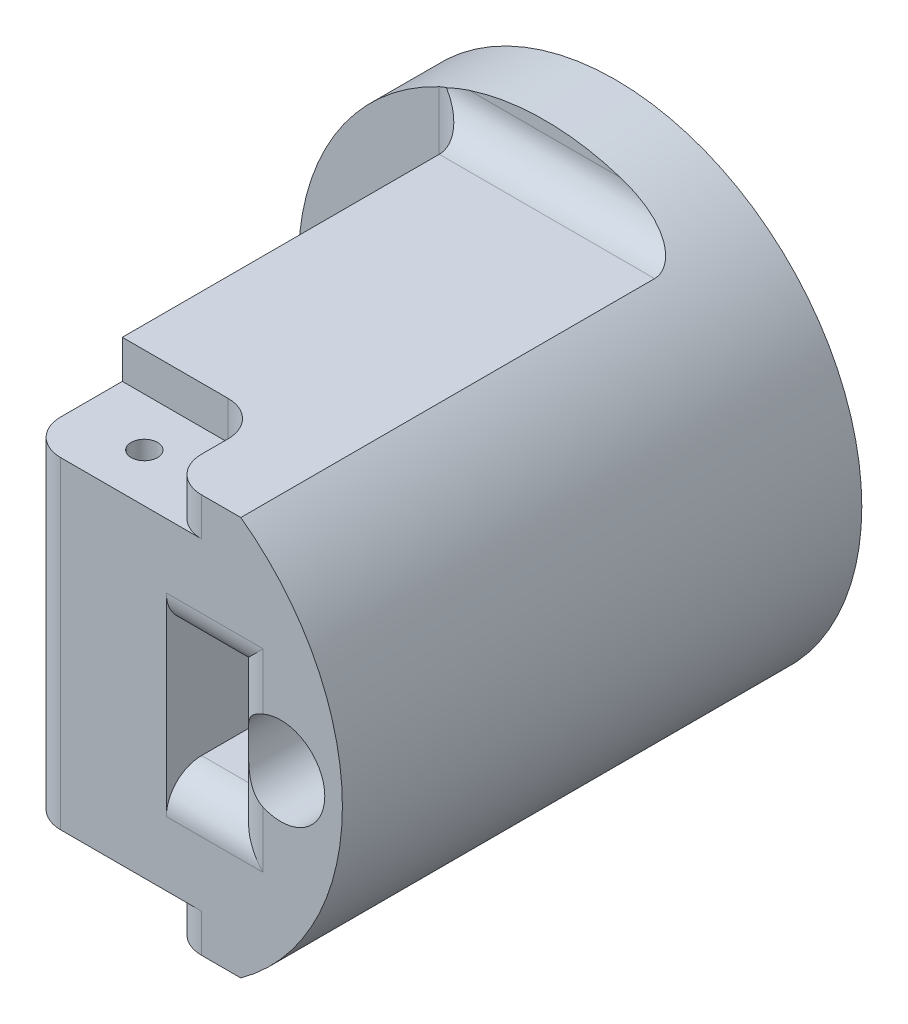
from build123d import *

# Parameters (mm, degrees)
SKETCH2_R           = 14
BOSS_EXTRUDE1_DEPTH = 4
SKETCH1_W           = 8
SKETCH1_H           = 22.649954628
SKETCH1_W_2         = 6
SKETCH1_H_2         = 18.4
BOSS_EXTRUDE2_DEPTH = 18
SKETCH3_W           = 8
SKETCH3_H           = 22.649954628
BOSS_EXTRUDE3_DEPTH = 2
SKETCH4_W           = 6
SKETCH4_H           = 18.4
CUT_EXTRUDE1_DEPTH  = 29.142494559
SKETCH5_W           = 5
SKETCH5_H           = 18.4
CUT_EXTRUDE2_DEPTH  = 33.57299495
SKETCH11_W          = 8
SKETCH11_H          = 18.310644234
BOSS_EXTRUDE5_DEPTH = 5.5
BOSS_EXTRUDE4_DEPTH = 25.5
CUT_EXTRUDE4_START  = 5.5
SKETCH9_W           = 3.5
SKETCH9_H           = 7
CUT_EXTRUDE4_DEPTH  = 6
SKETCH7_R           = 0.75
CUT_EXTRUDE5_DEPTH  = 41.03022536
FILLET3_R           = 1
FILLET4_R           = 2
FILLET5_R           = 2
SKETCH14_W          = 1.5
SKETCH14_H          = 2
FILLET6_R           = 2


# Some blends are built 0.0001 mm under size
with BuildPart() as part:
    # Sketch2 → Boss-Extrude1 (new body)
    with BuildSketch(Plane.XY):
        Circle(SKETCH2_R)
    extrude(amount=BOSS_EXTRUDE1_DEPTH)

    # Sketch1 → Boss-Extrude2 (add)
    with BuildSketch(Plane.XY.offset(4)):
        Rectangle(SKETCH1_W, SKETCH1_H)
        Rectangle(SKETCH1_W_2, SKETCH1_H_2, mode=Mode.SUBTRACT)
    extrude(amount=BOSS_EXTRUDE2_DEPTH)

    # Sketch3 → Boss-Extrude3 (add)
    with BuildSketch(Plane.XY.offset(22)):
        Rectangle(SKETCH3_W, SKETCH3_H)
    extrude(amount=BOSS_EXTRUDE3_DEPTH)

    # Sketch4 → Cut-Extrude1 (cut, through all)
    with BuildSketch(Plane.XY.offset(4)):
        Rectangle(SKETCH4_W, SKETCH4_H)
    extrude(amount=-CUT_EXTRUDE1_DEPTH, mode=Mode.SUBTRACT)

    # Sketch5 → Cut-Extrude2 (cut, through all)
    with BuildSketch(Plane.ZY.offset(-3)):
        with Locations((19.5, 0)):
            Rectangle(SKETCH5_W, SKETCH5_H)
    extrude(amount=CUT_EXTRUDE2_DEPTH, mode=Mode.SUBTRACT)

    # Sketch11 → Boss-Extrude5 (add)
    with BuildSketch(Plane.XY.offset(24)):
        Rectangle(SKETCH11_W, SKETCH11_H)
    extrude(amount=BOSS_EXTRUDE5_DEPTH)

    # Sketch8 → Boss-Extrude4 (add)
    with BuildSketch(Plane.XY.offset(4)):
        with BuildLine():
            Line((4, 11.324977314), (4, -11.324977314))
            Line((4, -11.324977314), (8.23072833, -11.324977314))
            ThreePointArc((8.23072833, -11.324977314), (12.474578081, -6.354911619), (14, 0))
            ThreePointArc((14, 0), (12.474578081, 6.354911619), (8.23072833, 11.324977314))
            Line((8.23072833, 11.324977314), (4, 11.324977314))
        make_face()
    extrude(amount=BOSS_EXTRUDE4_DEPTH)

    # Sketch9 → Cut-Extrude4 (cut)
    with BuildSketch(Plane.XY.offset(24).offset(CUT_EXTRUDE4_START)):
        with Locations((5.75, 0)):
            Rectangle(SKETCH9_W, SKETCH9_H)
    extrude(amount=-CUT_EXTRUDE4_DEPTH, mode=Mode.SUBTRACT)

    # Sketch7 → Cut-Extrude5 (cut, through all)
    with BuildSketch(Plane(origin=(0, -9.155322117, 0), x_dir=(1, 0, 0), z_dir=(0, 1, 0))):
        with Locations((0, -26.75)):
            Circle(SKETCH7_R)
    extrude(amount=CUT_EXTRUDE5_DEPTH, mode=Mode.SUBTRACT)

    # Fillet3
    fillet3_edges = [part.edges().sort_by_distance(p)[0] for p in [
        (-4, -9.2, 19.5),
        (-4, 0, 17),
        (-4, 9.2, 19.5),
    ]]
    fillet(fillet3_edges, radius=FILLET3_R - 0.0001)  # a hair under: the kernel refuses the full size

    # Fillet4
    # the kernel refuses this fillet: 2 mm, written as the material it adds along each edge
    with BuildSketch(Plane(origin=(13.23072833, -11.324977314, 4), x_dir=(0, -1, 0), z_dir=(-1, 0, 0))) as fillet4_piece_1_section:
        with BuildLine():
            CenterArc((FILLET4_R, FILLET4_R), FILLET4_R, 180, 90)
            Line((0, FILLET4_R), (0, 0))
            Line((0, 0), (FILLET4_R, 0))
        make_face()
    fillet4_piece_1 = extrude(amount=17.23072833, mode=Mode.PRIVATE)
    fillet4_piece_1 = fillet4_piece_1 & Plane(origin=(0, 0, 4.46853923), x_dir=(1, 0, 0), z_dir=(0, 0, -1)) * Cylinder(14, 43, mode=Mode.PRIVATE)
    add(fillet4_piece_1)
    with BuildSketch(Plane(origin=(-4, 11.324977314, 4), x_dir=(0, 0, 1), z_dir=(0, -1, 0))) as fillet4_piece_2:
        with BuildLine():
            CenterArc((FILLET4_R, FILLET4_R), FILLET4_R, 180, 90)
            Line((0, FILLET4_R), (0, 0))
            Line((0, 0), (FILLET4_R, 0))
        make_face()
    extrude(amount=22.649954628)
    with BuildSketch(Plane(origin=(-4, 11.324977314, 4), x_dir=(0, 1, 0), z_dir=(1, 0, 0))) as fillet4_piece_3_section:
        with BuildLine():
            CenterArc((FILLET4_R, FILLET4_R), FILLET4_R, 180, 90)
            Line((0, FILLET4_R), (0, 0))
            Line((0, 0), (FILLET4_R, 0))
        make_face()
    fillet4_piece_3 = extrude(amount=17.23072833, mode=Mode.PRIVATE)
    fillet4_piece_3 = fillet4_piece_3 & Plane(origin=(0, 0, 4.468539385), x_dir=(1, 0, 0), z_dir=(0, 0, -1)) * Cylinder(14, 43, mode=Mode.PRIVATE)
    add(fillet4_piece_3)
    with BuildSketch(Plane(origin=(-4, 11.324977314, 4), x_dir=(0, 0, 1), z_dir=(0, -1, 0))) as fillet4_piece_4a_section:
        with BuildLine():
            CenterArc((FILLET4_R, FILLET4_R), FILLET4_R, 180, 90)
            Line((0, FILLET4_R), (0, 0))
            Line((0, 0), (FILLET4_R, 0))
        make_face()
    fillet4_piece_4a = extrude(amount=27.649954628, mode=Mode.PRIVATE)
    fillet4_piece_4a = split(fillet4_piece_4a, bisect_by=Plane(origin=(-4.418611248, -11.324977314, 4.472457753), z_dir=(0, -1, 0)), keep=Keep.TOP, mode=Mode.PRIVATE)
    fillet4_piece_4a = fillet4_piece_4a & Plane(origin=(0, 0, 4.472457753), x_dir=(1, 0, 0), z_dir=(0, 0, -1)) * Cylinder(14, 64, mode=Mode.PRIVATE)
    with BuildSketch(Plane(origin=(13.23072833, -11.324977314, 4), x_dir=(0, -1, 0), z_dir=(-1, 0, 0))) as fillet4_piece_4b_section:
        with BuildLine():
            CenterArc((FILLET4_R, FILLET4_R), FILLET4_R, 180, 90)
            Line((0, FILLET4_R), (0, 0))
            Line((0, 0), (FILLET4_R, 0))
        make_face()
    fillet4_piece_4b = extrude(amount=22.23072833, mode=Mode.PRIVATE)
    fillet4_piece_4b = split(fillet4_piece_4b, bisect_by=Plane(origin=(-4, -11.687205264, 4.504335867), z_dir=(-1, 0, 0)), keep=Keep.TOP, mode=Mode.PRIVATE)
    fillet4_piece_4b = fillet4_piece_4b & Plane(origin=(0, 0, 4.504335867), x_dir=(1, 0, 0), z_dir=(0, 0, -1)) * Cylinder(14, 53, mode=Mode.PRIVATE)
    fillet4_piece_4 = fillet4_piece_4a & fillet4_piece_4b
    add(fillet4_piece_4)
    with BuildSketch(Plane(origin=(-4, 16.324977314, 4), x_dir=(0, 0, 1), z_dir=(0, -1, 0))) as fillet4_piece_5a_section:
        with BuildLine():
            CenterArc((FILLET4_R, FILLET4_R), FILLET4_R, 180, 90)
            Line((0, FILLET4_R), (0, 0))
            Line((0, 0), (FILLET4_R, 0))
        make_face()
    fillet4_piece_5a = extrude(amount=27.649954628, mode=Mode.PRIVATE)
    fillet4_piece_5a = split(fillet4_piece_5a, bisect_by=Plane(origin=(-4.418615633, 11.324977314, 4.472459709), z_dir=(0, 1, 0)), keep=Keep.TOP, mode=Mode.PRIVATE)
    fillet4_piece_5a = fillet4_piece_5a & Plane(origin=(0, 0, 4.472459709), x_dir=(1, 0, 0), z_dir=(0, 0, -1)) * Cylinder(14, 64, mode=Mode.PRIVATE)
    with BuildSketch(Plane(origin=(-9, 11.324977314, 4), x_dir=(0, 1, 0), z_dir=(1, 0, 0))) as fillet4_piece_5b_section:
        with BuildLine():
            CenterArc((FILLET4_R, FILLET4_R), FILLET4_R, 180, 90)
            Line((0, FILLET4_R), (0, 0))
            Line((0, 0), (FILLET4_R, 0))
        make_face()
    fillet4_piece_5b = extrude(amount=22.23072833, mode=Mode.PRIVATE)
    fillet4_piece_5b = split(fillet4_piece_5b, bisect_by=Plane(origin=(-4, 11.687206224, 4.504336165), z_dir=(-1, 0, 0)), keep=Keep.TOP, mode=Mode.PRIVATE)
    fillet4_piece_5b = fillet4_piece_5b & Plane(origin=(0, 0, 4.504336165), x_dir=(1, 0, 0), z_dir=(0, 0, -1)) * Cylinder(14, 53, mode=Mode.PRIVATE)
    fillet4_piece_5 = fillet4_piece_5a & fillet4_piece_5b
    add(fillet4_piece_5)

    # Fillet5
    fillet5_edges = [part.edges().sort_by_distance(p)[0] for p in [
        (3, 0, 22),
    ]]
    fillet(fillet5_edges, radius=FILLET5_R)

    # Sketch14 → Cut-Revolve1 (revolve, cut)
    with BuildSketch(Plane(origin=(0, 0, 0), x_dir=(1, 0, 0), z_dir=(0, 1, 0))):
        Polygon((10.5, -2), (10.5, -29.5), (13, -29.5), (13, -3.6), (12, -2), align=None)
        with Locations((11.25, -1)):
            Rectangle(SKETCH14_W, SKETCH14_H)
    cut_revolve1 = revolve(axis=Axis((10.5, 0, 29.5), (0, 0, -1)), mode=Mode.SUBTRACT)

    # Mirror1: Cut-Revolve1 across plane
    add(cut_revolve1.mirror(Plane(origin=(0, 0, 0), x_dir=(0, 0, 1), z_dir=(1, 0, 0))), mode=Mode.SUBTRACT)

    # Fillet6
    # the kernel refuses this fillet: 2 mm, written as the material it adds along each edge
    with BuildSketch(Plane(origin=(4, -11.324977314, 24), x_dir=(-1, 0, 0), z_dir=(0, 1, 0)), Plane(origin=(4, 4.155322117, 24), x_dir=(-1, 0, 0), z_dir=(0, 1, 0))) as fillet6_piece_1:
        with BuildLine():
            CenterArc((FILLET6_R, FILLET6_R), FILLET6_R, 180, 90)
            Line((0, FILLET6_R), (0, 0))
            Line((0, 0), (FILLET6_R, 0))
        make_face()
    extrude(amount=7.169655197)
    # the kernel refuses this fillet: 2 mm, written as the material it takes off along each edge
    with BuildSketch(Plane(origin=(4, 16.324977314, 29.5), x_dir=(1, 0, 0), z_dir=(0, -1, 0)), Plane(origin=(4, -9.155322117, 29.5), x_dir=(1, 0, 0), z_dir=(0, -1, 0))) as fillet6_2_piece_1:
        with BuildLine():
            CenterArc((FILLET6_R, -FILLET6_R), FILLET6_R, 90, 90)
            Line((0, -FILLET6_R), (0, 0))
            Line((0, 0), (FILLET6_R, 0))
        make_face()
    extrude(amount=7.169655197, mode=Mode.SUBTRACT)
    with BuildSketch(Plane(origin=(7.5, 3.5, 29.5), x_dir=(0, 1, 0), z_dir=(-1, 0, 0)), Plane(origin=(4, -3.5, 29.5), x_dir=(0, -1, 0), z_dir=(1, 0, 0))) as fillet6_2_piece_2:
        with BuildLine():
            CenterArc((FILLET6_R, FILLET6_R), FILLET6_R, 180, 90)
            Line((0, FILLET6_R), (0, 0))
            Line((0, 0), (FILLET6_R, 0))
        make_face()
    extrude(amount=3.5, mode=Mode.SUBTRACT)
    with BuildSketch(Plane(origin=(7.5, -3.5, 29.5), x_dir=(1, 0, 0), z_dir=(0, 1, 0))) as fillet6_2_piece_3:
        with BuildLine():
            CenterArc((FILLET6_R, FILLET6_R), FILLET6_R, 180, 90)
            Line((0, FILLET6_R), (0, 0))
            Line((0, 0), (FILLET6_R, 0))
        make_face()
    extrude(amount=7, mode=Mode.SUBTRACT)
    with BuildSketch(Plane(origin=(-4, 14.155322117, 29.5), x_dir=(0, 0, -1), z_dir=(0, -1, 0))) as fillet6_2_piece_4:
        with BuildLine():
            CenterArc((FILLET6_R, FILLET6_R), FILLET6_R, 180, 90)
            Line((0, FILLET6_R), (0, 0))
            Line((0, 0), (FILLET6_R, 0))
        make_face()
    extrude(amount=28.310644234, mode=Mode.SUBTRACT)
    with BuildSketch(Plane(origin=(12.5, 3.5, 29.5), x_dir=(0, 1, 0), z_dir=(-1, 0, 0))) as fillet6_2_piece_5a_section:
        with BuildLine():
            CenterArc((FILLET6_R, FILLET6_R), FILLET6_R, 180, 90)
            Line((0, FILLET6_R), (0, 0))
            Line((0, 0), (FILLET6_R, 0))
        make_face()
    fillet6_2_piece_5a = extrude(amount=8.5, mode=Mode.PRIVATE)
    fillet6_2_piece_5a = split(fillet6_2_piece_5a, bisect_by=Plane(origin=(7.5, 3.952790229, 29.047209771), z_dir=(1, 0, 0)), keep=Keep.TOP, mode=Mode.PRIVATE)
    with BuildSketch(Plane(origin=(7.5, -3.5, 29.5), x_dir=(1, 0, 0), z_dir=(0, 1, 0))) as fillet6_2_piece_5b_section:
        with BuildLine():
            CenterArc((FILLET6_R, FILLET6_R), FILLET6_R, 180, 90)
            Line((0, FILLET6_R), (0, 0))
            Line((0, 0), (FILLET6_R, 0))
        make_face()
    fillet6_2_piece_5b = extrude(amount=12, mode=Mode.PRIVATE)
    fillet6_2_piece_5b = split(fillet6_2_piece_5b, bisect_by=Plane(origin=(7.952790229, 3.5, 29.047209771), z_dir=(0, 1, 0)), keep=Keep.TOP, mode=Mode.PRIVATE)
    fillet6_2_piece_5 = fillet6_2_piece_5a & fillet6_2_piece_5b
    add(fillet6_2_piece_5, mode=Mode.SUBTRACT)
    with BuildSketch(Plane(origin=(4, -3.5, 29.5), x_dir=(0, -1, 0), z_dir=(1, 0, 0))) as fillet6_2_piece_6a_section:
        with BuildLine():
            CenterArc((FILLET6_R, FILLET6_R), FILLET6_R, 180, 90)
            Line((0, FILLET6_R), (0, 0))
            Line((0, 0), (FILLET6_R, 0))
        make_face()
    fillet6_2_piece_6a = extrude(amount=8.5, mode=Mode.PRIVATE)
    fillet6_2_piece_6a = split(fillet6_2_piece_6a, bisect_by=Plane(origin=(7.5, -3.952790229, 29.047209771), z_dir=(1, 0, 0)), keep=Keep.TOP, mode=Mode.PRIVATE)
    with BuildSketch(Plane(origin=(7.5, -8.5, 29.5), x_dir=(1, 0, 0), z_dir=(0, 1, 0))) as fillet6_2_piece_6b_section:
        with BuildLine():
            CenterArc((FILLET6_R, FILLET6_R), FILLET6_R, 180, 90)
            Line((0, FILLET6_R), (0, 0))
            Line((0, 0), (FILLET6_R, 0))
        make_face()
    fillet6_2_piece_6b = extrude(amount=12, mode=Mode.PRIVATE)
    fillet6_2_piece_6b = split(fillet6_2_piece_6b, bisect_by=Plane(origin=(7.952790229, -3.5, 29.047209771), z_dir=(0, -1, 0)), keep=Keep.TOP, mode=Mode.PRIVATE)
    fillet6_2_piece_6 = fillet6_2_piece_6a & fillet6_2_piece_6b
    add(fillet6_2_piece_6, mode=Mode.SUBTRACT)


solid = part.part
